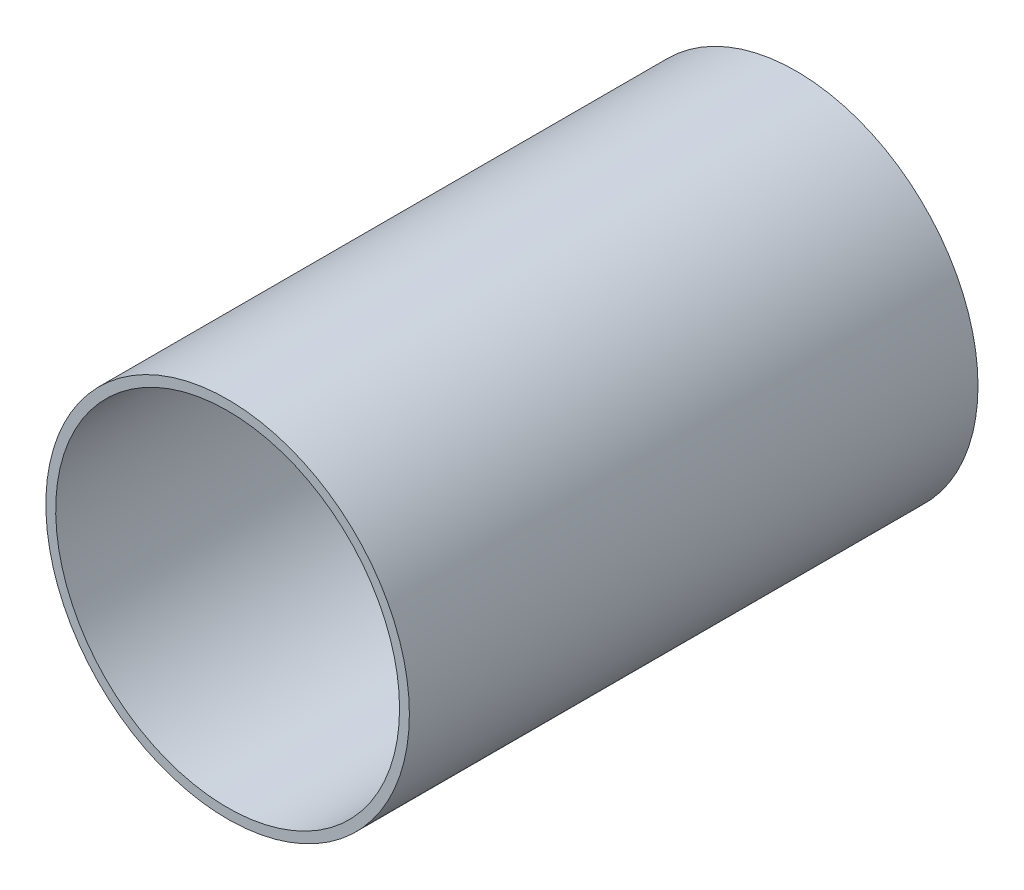
from build123d import *

# Parameters (mm, degrees)
SKETCH1_R                            = 46.99
SKETCH1_R_2                          = 44.45
EXTRUDE_THIN1_DEPTH                  = 147
EXTRUDE_THIN2_REACH                  = 163.323
EXTRUDE_THIN2_END_RADIUS             = 44.45
SKETCH3_W                            = 2
SKETCH3_H                            = 32.54
EXTRUDE_THIN2_DIRECTION_2_REACH      = 163.323
EXTRUDE_THIN2_DIRECTION_2_END_RADIUS = 44.45
LPATTERN4_DEPTH                      = 32.54
LPATTERN5_DEPTH                      = 32.54


# Read off the part's stored shape, not the designer's step: LPattern4, LPattern5
with BuildPart() as part:
    # Sketch1 → Extrude-Thin1 (new body)
    with BuildSketch(Plane.XY):
        Circle(SKETCH1_R)
        Circle(SKETCH1_R_2, mode=Mode.SUBTRACT)
    extrude(amount=EXTRUDE_THIN1_DEPTH)

    # Extrude-Thin2: up to this cylinder (the profile starts inside it)
    extrude_thin2_end = Plane(origin=(0, 0, 16.27), z_dir=(0, 0, -1)) * Cylinder(EXTRUDE_THIN2_END_RADIUS, 416.546, mode=Mode.PRIVATE)
    # Sketch3 → Extrude-Thin2 (add, up to the surface)
    with BuildSketch(Plane(origin=(0, 0, 0), x_dir=(1, 0, 0), z_dir=(0, 1, 0)), mode=Mode.PRIVATE) as extrude_thin2_sk1:
        with Locations((0, -16.27)):
            Rectangle(SKETCH3_W, SKETCH3_H)
    extrude_thin2_tool1 = extrude(extrude_thin2_sk1.sketch, amount=EXTRUDE_THIN2_REACH, mode=Mode.PRIVATE) & extrude_thin2_end
    extrude_thin2 = extrude_thin2_tool1.solids().sort_by_distance((0, 0, 16.27))[0]
    add(extrude_thin2)

    # Extrude-Thin2 direction 2: up to this cylinder (the profile starts inside it)
    extrude_thin2_direction_2_end = Plane(origin=(0, 0, 16.27), z_dir=(0, 0, -1)) * Cylinder(EXTRUDE_THIN2_DIRECTION_2_END_RADIUS, 416.546, mode=Mode.PRIVATE)
    # Sketch3 → Extrude-Thin2 direction 2 (add, up to the surface)
    with BuildSketch(Plane(origin=(0, 0, 0), x_dir=(1, 0, 0), z_dir=(0, 1, 0)), mode=Mode.PRIVATE) as extrude_thin2_direction_2_sk1:
        with Locations((0, -16.27)):
            Rectangle(SKETCH3_W, SKETCH3_H)
    extrude_thin2_direction_2_tool1 = extrude(extrude_thin2_direction_2_sk1.sketch, amount=-EXTRUDE_THIN2_DIRECTION_2_REACH, mode=Mode.PRIVATE) & extrude_thin2_direction_2_end
    extrude_thin2_direction_2 = extrude_thin2_direction_2_tool1.solids().sort_by_distance((0, 0, 16.27))[0]
    add(extrude_thin2_direction_2)
    extrude_thin2 = extrude_thin2 + extrude_thin2_direction_2  # both directions under the feature's name, for the pattern or mirror that repeats it

    # LPattern4 outline → LPattern4 (add)
    with BuildSketch(Plane.XY):
        with BuildLine():
            ThreePointArc((6, 44.043189031), (5.001282025, 44.16774477), (4, 44.269656651))
            Line((4, 44.269656651), (4, -44.269656651))
            ThreePointArc((4, -44.269656651), (5.001282025, -44.16774477), (6, -44.043189031))
            Line((6, -44.043189031), (6, 44.043189031))
        make_face()
        with BuildLine():
            ThreePointArc((11, 43.067418079), (10.002666668, 43.309919874), (9, 43.529329193))
            Line((9, 43.529329193), (9, -43.529329193))
            ThreePointArc((9, -43.529329193), (10.002666668, -43.309919874), (11, -43.067418079))
            Line((11, -43.067418079), (11, 43.067418079))
        make_face()
        with BuildLine():
            ThreePointArc((16, 41.470501564), (15.004285901, 41.841055252), (14, 42.187705555))
            Line((14, 42.187705555), (14, -42.187705555))
            ThreePointArc((14, -42.187705555), (15.004285901, -41.841055252), (16, -41.470501564))
            Line((16, -41.470501564), (16, 41.470501564))
        make_face()
        with BuildLine():
            ThreePointArc((21, 39.176555489), (20.006350019, 39.693178997), (19, 40.184605261))
            Line((19, 40.184605261), (19, -40.184605261))
            ThreePointArc((19, -40.184605261), (20.006350019, -39.693178997), (21, -39.176555489))
            Line((21, -39.176555489), (21, 39.176555489))
        make_face()
        with BuildLine():
            ThreePointArc((26, 36.052773818), (25.009262077, 36.746963281), (24, 37.41393457))
            Line((24, 37.41393457), (24, -37.41393457))
            ThreePointArc((24, -37.41393457), (25.009262077, -36.746963281), (26, -36.052773818))
            Line((26, -36.052773818), (26, 36.052773818))
        make_face()
        with BuildLine():
            ThreePointArc((31, 31.855964905), (30.013963692, 32.786650995), (29, 33.686829771))
            Line((29, 33.686829771), (29, -33.686829771))
            ThreePointArc((29, -33.686829771), (30.013963692, -32.786650995), (31, -31.855964905))
            Line((31, -31.855964905), (31, 31.855964905))
        make_face()
        with BuildLine():
            ThreePointArc((36, 26.073022456), (35.023382747, 27.370881626), (34, 28.632193419))
            Line((34, 28.632193419), (34, -28.632193419))
            ThreePointArc((34, -28.632193419), (35.023382747, -27.370881626), (36, -26.073022456))
            Line((36, -26.073022456), (36, 26.073022456))
        make_face()
    lpattern4 = extrude(amount=LPATTERN4_DEPTH)

    # LPattern5 outline → LPattern5 (add)
    with BuildSketch(Plane.XY):
        with BuildLine():
            ThreePointArc((-4, 44.269656651), (-5.001282025, 44.16774477), (-6, 44.043189031))
            Line((-6, 44.043189031), (-6, -44.043189031))
            ThreePointArc((-6, -44.043189031), (-5.001282025, -44.16774477), (-4, -44.269656651))
            Line((-4, -44.269656651), (-4, 44.269656651))
        make_face()
        with BuildLine():
            Line((-9, -43.529329193), (-9, 43.529329193))
            ThreePointArc((-9, 43.529329193), (-10.002666668, 43.309919874), (-11, 43.067418079))
            Line((-11, 43.067418079), (-11, -43.067418079))
            ThreePointArc((-11, -43.067418079), (-10.002666668, -43.309919874), (-9, -43.529329193))
        make_face()
        with BuildLine():
            Line((-14, -42.187705555), (-14, 42.187705555))
            ThreePointArc((-14, 42.187705555), (-15.004285901, 41.841055252), (-16, 41.470501564))
            Line((-16, 41.470501564), (-16, -41.470501564))
            ThreePointArc((-16, -41.470501564), (-15.004285901, -41.841055252), (-14, -42.187705555))
        make_face()
        with BuildLine():
            Line((-19, -40.184605261), (-19, 40.184605261))
            ThreePointArc((-19, 40.184605261), (-20.006350019, 39.693178997), (-21, 39.176555489))
            Line((-21, 39.176555489), (-21, -39.176555489))
            ThreePointArc((-21, -39.176555489), (-20.006350019, -39.693178997), (-19, -40.184605261))
        make_face()
        with BuildLine():
            Line((-24, -37.41393457), (-24, 37.41393457))
            ThreePointArc((-24, 37.41393457), (-25.009262077, 36.746963281), (-26, 36.052773818))
            Line((-26, 36.052773818), (-26, -36.052773818))
            ThreePointArc((-26, -36.052773818), (-25.009262077, -36.746963281), (-24, -37.41393457))
        make_face()
        with BuildLine():
            Line((-29, -33.686829771), (-29, 33.686829771))
            ThreePointArc((-29, 33.686829771), (-30.013963692, 32.786650995), (-31, 31.855964905))
            Line((-31, 31.855964905), (-31, -31.855964905))
            ThreePointArc((-31, -31.855964905), (-30.013963692, -32.786650995), (-29, -33.686829771))
        make_face()
        with BuildLine():
            Line((-34, -28.632193419), (-34, 28.632193419))
            ThreePointArc((-34, 28.632193419), (-35.023382747, 27.370881626), (-36, 26.073022456))
            Line((-36, 26.073022456), (-36, -26.073022456))
            ThreePointArc((-36, -26.073022456), (-35.023382747, -27.370881626), (-34, -28.632193419))
        make_face()
    lpattern5 = extrude(amount=LPATTERN5_DEPTH)

    # Mirror1: Extrude-Thin2, LPattern4 across plane
    add(extrude_thin2.mirror(Plane(origin=(0, 0, 0), x_dir=(0, 0, 1), z_dir=(0.7071067811865475, -0.7071067811865477, 0))))
    add(lpattern4.mirror(Plane(origin=(0, 0, 0), x_dir=(0, 0, 1), z_dir=(0.7071067811865475, -0.7071067811865477, 0))))

    # Mirror2: LPattern5 across plane
    add(lpattern5.mirror(Plane(origin=(0, 0, 0), x_dir=(0, 0, 1), z_dir=(0.7071067811865475, -0.7071067811865477, 0))))


solid = part.part
